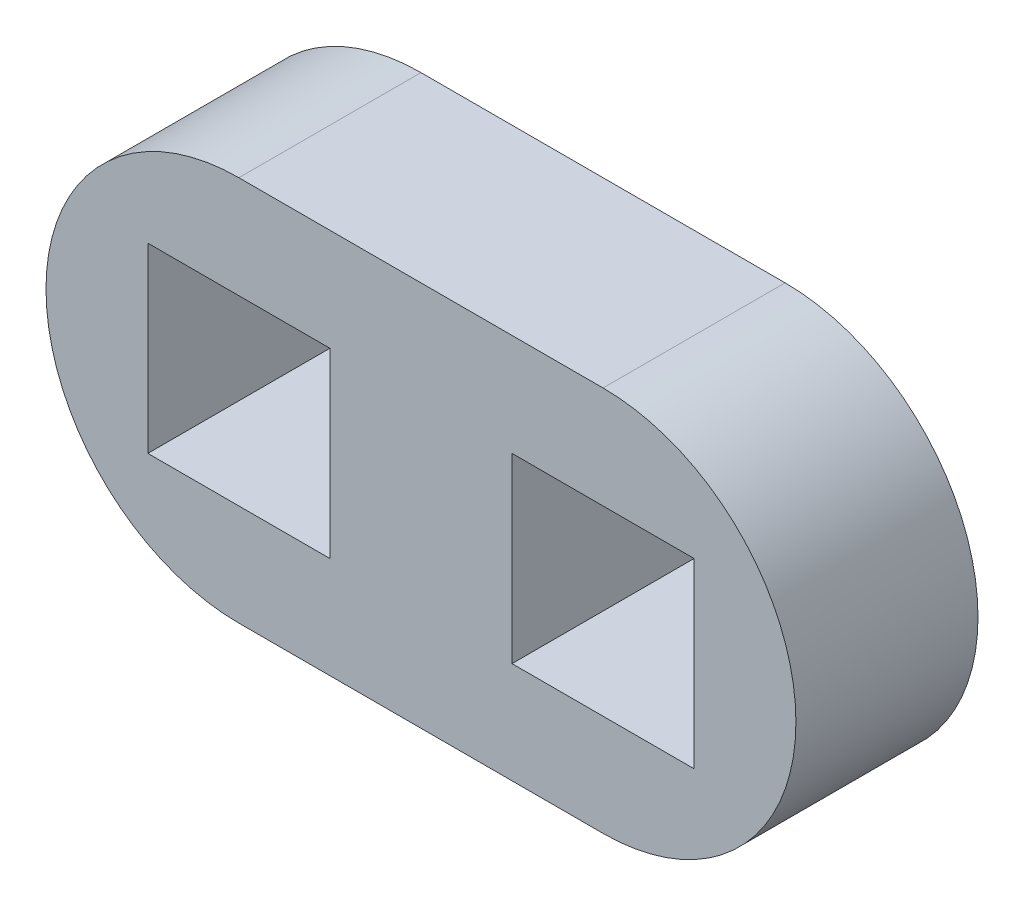
from build123d import *

# Parameters (mm, degrees)
SKETCH1_W           = 5.9944
SKETCH1_H           = 5.9944
BOSS_EXTRUDE1_DEPTH = 5.9944


with BuildPart() as part:
    # Sketch1 → Boss-Extrude1 (new body)
    with BuildSketch(Plane.XY):
        with BuildLine():
            Line((372.621740851, 124.352248421), (384.610540851, 124.352248421))
            ThreePointArc((384.610540851, 124.352248421), (390.960540851, 118.002248421), (384.610540851, 111.652248421))
            Line((384.610540851, 111.652248421), (372.621740851, 111.652248421))
            ThreePointArc((372.621740851, 111.652248421), (366.271740851, 118.002248421), (372.621740851, 124.352248421))
        make_face()
        with Locations((384.610540851, 117.991248441)):
            Rectangle(SKETCH1_W, SKETCH1_H, mode=Mode.SUBTRACT)
        with Locations((372.621740851, 117.991248441)):
            Rectangle(SKETCH1_W, SKETCH1_H, mode=Mode.SUBTRACT)
    extrude(amount=BOSS_EXTRUDE1_DEPTH)


solid = part.part
